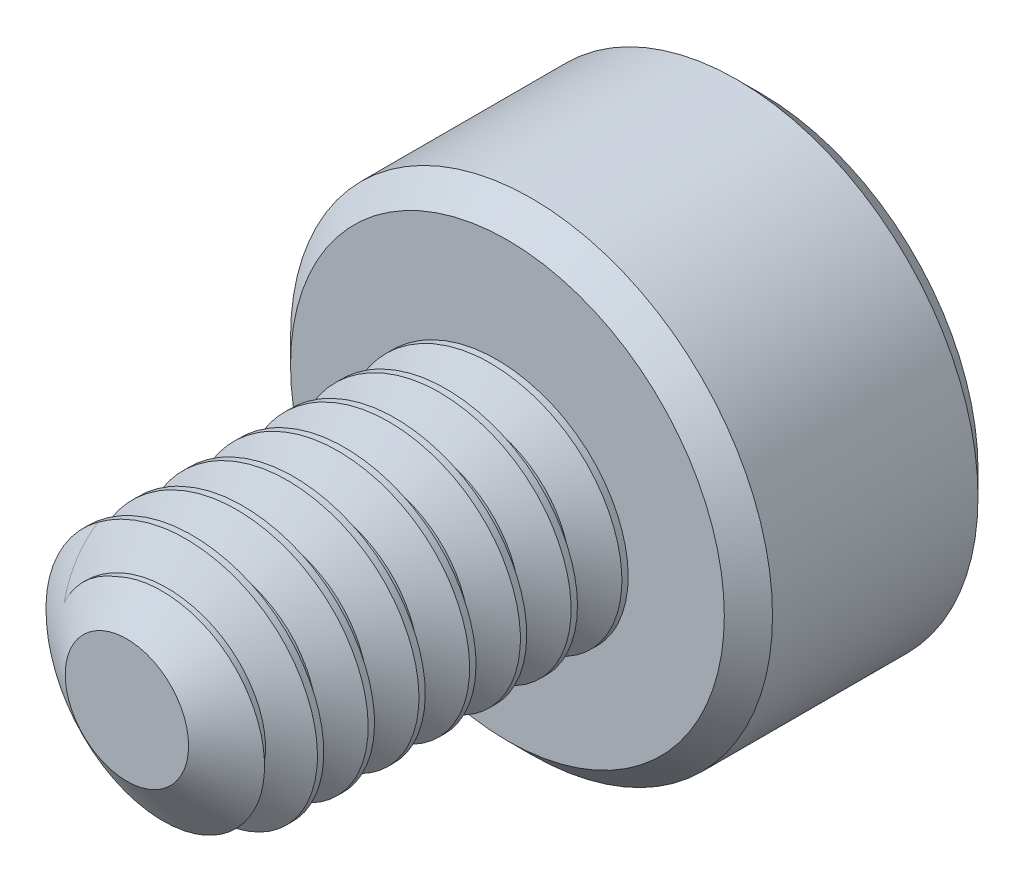
from build123d import *

# Parameters (mm, degrees)
SKETCH1_R          = 1
EXTRUDE1_DEPTH     = 3
CUT_SWEEP1_PITCH   = 0.4
SKETCH6_R          = 1.9
EXTRUDE2_DEPTH     = 2
CUT_EXTRUDE1_DEPTH = 1.125
CHAMFER1_SIZE      = 0.19


with BuildPart() as part:
    # Sketch1 → Extrude1 (new body)
    with BuildSketch(Plane.XY):
        Circle(SKETCH1_R)
    extrude(amount=-EXTRUDE1_DEPTH)

    # Cut-Sweep1: the profile of Sketch3 profile screwed along a right-hand helix of 8.5 turns, 6 arcs to a turn; built about Z, then put on its axis
    cut_sweep1_z = Axis((0, 0, 0), (0, 0, 1))
    cut_sweep1_corners = [(1.0003, 0, -0.350173205), (0.740192379, 0, -0.2), (0.740192379, 0, -0.15), (1.0003, 0, 0.000173205)]
    with BuildLine(mode=Mode.PRIVATE) as cut_sweep1_profile:
        Line(cut_sweep1_corners[0], cut_sweep1_corners[1])
        Line(cut_sweep1_corners[1], cut_sweep1_corners[2])
        Line(cut_sweep1_corners[2], cut_sweep1_corners[3])
        Line(cut_sweep1_corners[3], cut_sweep1_corners[0])
    cut_sweep1_cap = Face(cut_sweep1_profile.wire())
    cut_sweep1_turn_angles = [0, 30, 60, 90, 120, 150, 180, 210, 240, 270, 300, 330, 360]
    cut_sweep1_turn_weights = [1, 0.8660254037844387, 1, 0.8660254037844387, 1, 0.8660254037844387, 1, 0.8660254037844387, 1, 0.8660254037844387, 1, 0.8660254037844387, 1]
    cut_sweep1_turn_rails = [Edge.make_bspline([Vector(p[0], p[1], 0).rotate(cut_sweep1_z, cut_sweep1_turn_angles[k]) / cut_sweep1_turn_weights[k] + Vector(0, 0, p[2] + CUT_SWEEP1_PITCH * cut_sweep1_turn_angles[k] / 360) for k in range(13)], [0, 0, 0, 1, 1, 2, 2, 3, 3, 4, 4, 5, 5, 6, 6, 6], 2, cut_sweep1_turn_weights) for p in cut_sweep1_corners]
    cut_sweep1_turn_sides = [Face.make_surface_from_curves(cut_sweep1_turn_rails[p[0]], cut_sweep1_turn_rails[p[1]]) for p in [(0, 1), (1, 2), (2, 3), (3, 0)]]
    cut_sweep1_last_angles = [2880, 2910, 2940, 2970, 3000, 3030, 3060]
    cut_sweep1_last_weights = [1, 0.8660254037844387, 1, 0.8660254037844387, 1, 0.8660254037844327, 1]
    cut_sweep1_last_rails = [Edge.make_bspline([Vector(p[0], p[1], 0).rotate(cut_sweep1_z, cut_sweep1_last_angles[k]) / cut_sweep1_last_weights[k] + Vector(0, 0, p[2] + CUT_SWEEP1_PITCH * cut_sweep1_last_angles[k] / 360) for k in range(7)], [0, 0, 0, 1, 1, 2, 2, 3, 3, 3], 2, cut_sweep1_last_weights) for p in cut_sweep1_corners]
    cut_sweep1_last_sides = [Face.make_surface_from_curves(cut_sweep1_last_rails[p[0]], cut_sweep1_last_rails[p[1]]) for p in [(0, 1), (1, 2), (2, 3), (3, 0)]]
    cut_sweep1 = Plane(origin=(0, 0, 0), x_dir=(0, 1, 0), z_dir=(0, 0, -1)) * Solid(Shell([*[p.moved(Location((0, 0, CUT_SWEEP1_PITCH * i))) for i in range(8) for p in cut_sweep1_turn_sides], *cut_sweep1_last_sides, cut_sweep1_cap, cut_sweep1_cap.rotate(cut_sweep1_z, 3060).moved(Location((0, 0, CUT_SWEEP1_PITCH * 3060 / 360)))]))
    add(cut_sweep1, mode=Mode.SUBTRACT)

    # Sketch4 → Cut-Revolve1 (revolve, cut)
    with BuildSketch(Plane(origin=(0, 0, 0), x_dir=(0, 0, -1), z_dir=(1, 0, 0)), mode=Mode.PRIVATE) as cut_revolve1_sk:
        Polygon((0.35977197, 1), (0, 0.486192379), (0, 1), align=None)
    revolve(cut_revolve1_sk.sketch.rotate(Axis((0, 0, 0), (0, 0, -1)), 278.428757719), axis=Axis((0, 0, 0), (0, 0, -1)), mode=Mode.SUBTRACT)

    # Sketch6 → Extrude2 (add)
    with BuildSketch(Plane(origin=(0, 0, -3), x_dir=(-1, 0, 0), z_dir=(0, 0, -1))):
        Circle(SKETCH6_R)
    extrude(amount=EXTRUDE2_DEPTH)

    # Sketch7 → Cut-Extrude1 (cut)
    with BuildSketch(Plane(origin=(0, 0, -5), x_dir=(-1, 0, 0), z_dir=(0, 0, -1))):
        Polygon((0, 0.866025404), (-0.75, 0.433012702), (-0.75, -0.433012702), (0, -0.866025404), (0.75, -0.433012702), (0.75, 0.433012702), align=None)
    extrude(amount=-CUT_EXTRUDE1_DEPTH, mode=Mode.SUBTRACT)

    # Cut-Extrude2 cone 1 section (through the dimple's axis) → Cut-Extrude2 (revolve, cut)
    with BuildSketch(Plane(origin=(0, 0, -5), x_dir=(0, 1, 0), z_dir=(1, 0, 0))):
        Polygon((0, 0), (0.866025404, 0), (0, 0.866025404), align=None)
    revolve(axis=Axis((0, 0, -5), (0, 0, 1)), mode=Mode.SUBTRACT)

    # Chamfer1
    chamfer1_edges = [part.edges().sort_by_distance(p)[0] for p in [
        (1.9, 0, -3),
        (1.9, 0, -5),
    ]]
    chamfer(chamfer1_edges, length=CHAMFER1_SIZE)


solid = part.part
